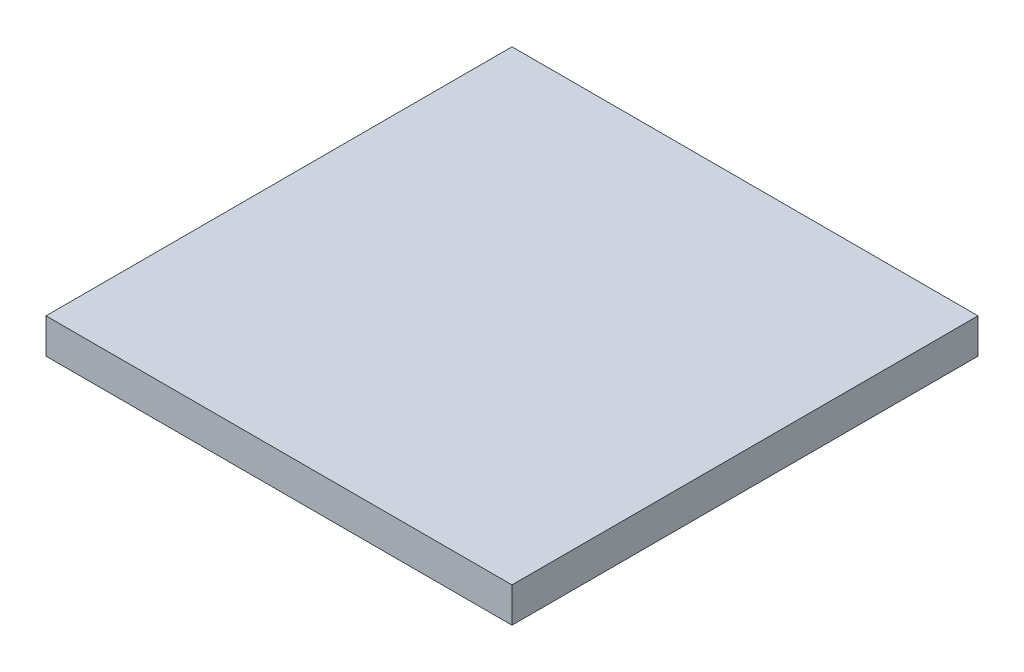
from build123d import *

# Parameters (mm, degrees)
SKETCH1_W           = 80
SKETCH1_H           = 80
BOSS_EXTRUDE1_DEPTH = 6


with BuildPart() as part:
    # Sketch1 → Boss-Extrude1 (new body)
    with BuildSketch(Plane(origin=(0, 0, 0), x_dir=(1, 0, 0), z_dir=(0, 1, 0))):
        Rectangle(SKETCH1_W, SKETCH1_H)
    extrude(amount=BOSS_EXTRUDE1_DEPTH)


solid = part.part
